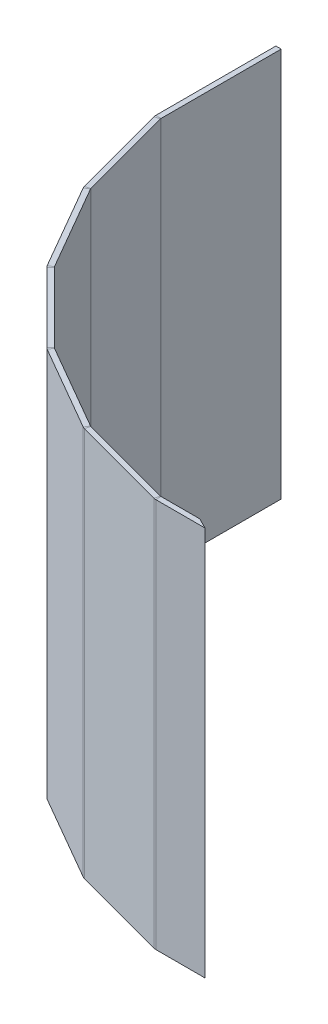
from build123d import *

# Parameters (mm, degrees)
BASE_FLANGE1_DEPTH = 110
CHAMFER1_SIZE2     = 3
CHAMFER1_SIZE      = 1.5


# Sheet-metal steps are written as plain solids
with BuildPart() as part:
    # Sketch1 → Base-Flange1 (new body)
    with BuildSketch(Plane(origin=(0, 0, 0), x_dir=(1, 0, 0), z_dir=(0, 1, 0))):
        with BuildLine():
            Line((0, 0), (0, -20))
            Line((0, -20), (0, -33.90302477))
            ThreePointArc((0, -33.90302477), (0.006301715, -33.999170363), (0.025099036, -34.093670879))
            Line((0.025099036, -34.093670879), (7.221834227, -60.952252257))
            ThreePointArc((7.221834227, -60.952252257), (7.252805527, -61.043490765), (7.295420878, -61.129906149))
            Line((7.295420878, -61.129906149), (21.198445648, -85.21065143))
            ThreePointArc((21.198445648, -85.21065143), (21.25197589, -85.290765098), (21.315505105, -85.363206285))
            Line((21.315505105, -85.363206285), (40.977351294, -105.025052473))
            ThreePointArc((40.977351294, -105.025052473), (41.04979248, -105.088581688), (41.129906149, -105.14211193))
            Line((41.129906149, -105.14211193), (65.21065143, -119.0451367))
            ThreePointArc((65.21065143, -119.0451367), (65.297066813, -119.087752052), (65.388305321, -119.118723352))
            Line((65.388305321, -119.118723352), (92.246886699, -126.315458542))
            ThreePointArc((92.246886699, -126.315458542), (92.341387215, -126.334255863), (92.437532808, -126.340557578))
            Line((92.437532808, -126.340557578), (106.340557578, -126.340557578))
            Line((106.340557578, -126.340557578), (106.340557578, -127.840557578))
            Line((106.340557578, -127.840557578), (92.437532808, -127.840557578))
            ThreePointArc((92.437532808, -127.840557578), (92.145597926, -127.821423155), (91.858658132, -127.764347281))
            Line((91.858658132, -127.764347281), (65.000076753, -120.567612091))
            ThreePointArc((65.000076753, -120.567612091), (64.723041665, -120.47357135), (64.46065143, -120.344174806))
            Line((64.46065143, -120.344174806), (40.379906149, -106.441150036))
            ThreePointArc((40.379906148, -106.441150036), (40.136650336, -106.278611699), (39.916691122, -106.085712644))
            Line((39.916691122, -106.085712645), (20.254844934, -86.423866456))
            ThreePointArc((20.254844934, -86.423866456), (20.06194588, -86.203907242), (19.899407542, -85.96065143))
            Line((19.899407542, -85.96065143), (5.996382772, -61.879906149))
            ThreePointArc((5.996382772, -61.879906149), (5.866986228, -61.617515913), (5.772945487, -61.340480825))
            Line((5.772945487, -61.340480825), (-1.423789703, -34.481899447))
            ThreePointArc((-1.423789703, -34.481899447), (-1.480865577, -34.194959652), (-1.5, -33.90302477))
            Line((-1.5, -33.90302477), (-1.5, -20))
            Line((-1.5, -20), (-1.5, 0))
            Line((-1.5, 0), (0, 0))
        make_face()
    extrude(amount=BASE_FLANGE1_DEPTH)

    # Chamfer1
    chamfer1_edges = [part.edges().sort_by_distance(p)[0] for p in [
        (106.340557578, 55, 126.340557578),
    ]]
    chamfer1_side = [part.faces().sort_by_distance(p)[0] for p in [
        (106.340557578, 55, 126.370557578),
    ]]
    chamfer(chamfer1_edges, length=CHAMFER1_SIZE - 0.0001, length2=CHAMFER1_SIZE2 - 0.0001, reference=chamfer1_side[0])  # a hair under: the kernel refuses the full size


solid = part.part
